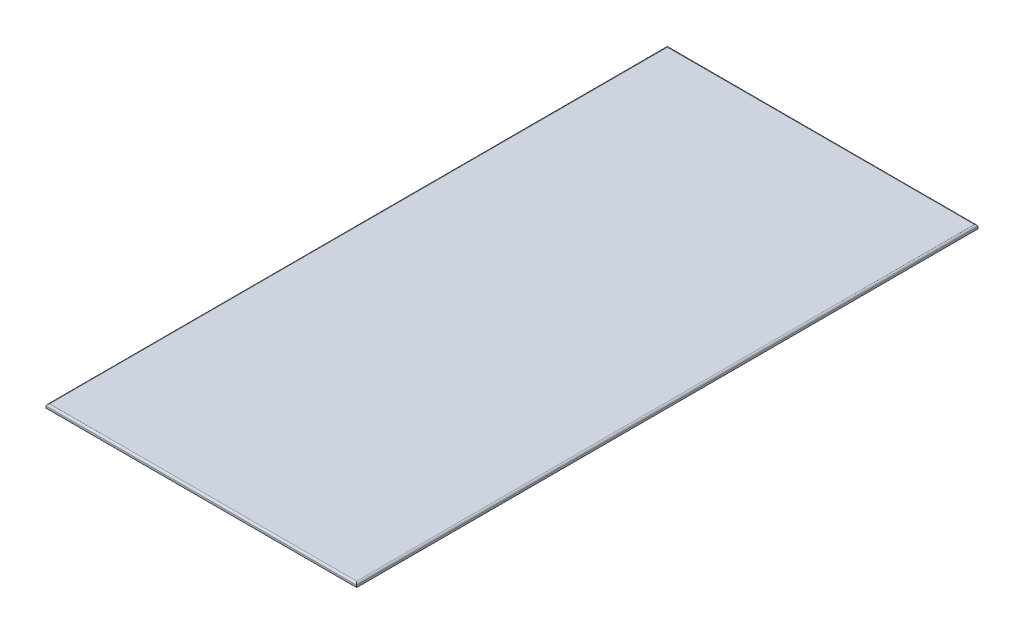
from build123d import *

# Parameters (mm, degrees)
SKETCH1_W           = 500
SKETCH1_H           = 1000
BOSS_EXTRUDE1_DEPTH = 6
FILLET1_R           = 3
SKETCH3_W           = 400
SKETCH3_H           = 900
BOSS_EXTRUDE2_DEPTH = 26
FILLET2_R           = 6


with BuildPart() as part:
    # Sketch1 → Boss-Extrude1 (new body)
    with BuildSketch(Plane(origin=(0, 0, 0), x_dir=(1, 0, 0), z_dir=(0, 1, 0))):
        with Locations((250, 500)):
            Rectangle(SKETCH1_W, SKETCH1_H)
    extrude(amount=BOSS_EXTRUDE1_DEPTH)

    # Fillet1
    fillet1_edges = [part.edges().sort_by_distance(p)[0] for p in [
        (250, 6, -1000),
        (500, 6, -500),
        (250, 6, 0),
        (0, 6, -500),
    ]]
    fillet(fillet1_edges, radius=FILLET1_R)

    # Sketch3 → Boss-Extrude2 (add)
    with BuildSketch(Plane.XZ):
        with Locations((250, -500)):
            Rectangle(SKETCH3_W, SKETCH3_H)
    extrude(amount=BOSS_EXTRUDE2_DEPTH)

    # Fillet2
    fillet2_edges = [part.edges().sort_by_distance(p)[0] for p in [
        (50, -26, -500),
        (250, -26, -50),
        (450, -26, -500),
        (250, -26, -950),
        (50, -13, -50),
        (50, -13, -950),
        (450, -13, -950),
        (450, -13, -50),
    ]]
    fillet(fillet2_edges, radius=FILLET2_R)


solid = part.part
